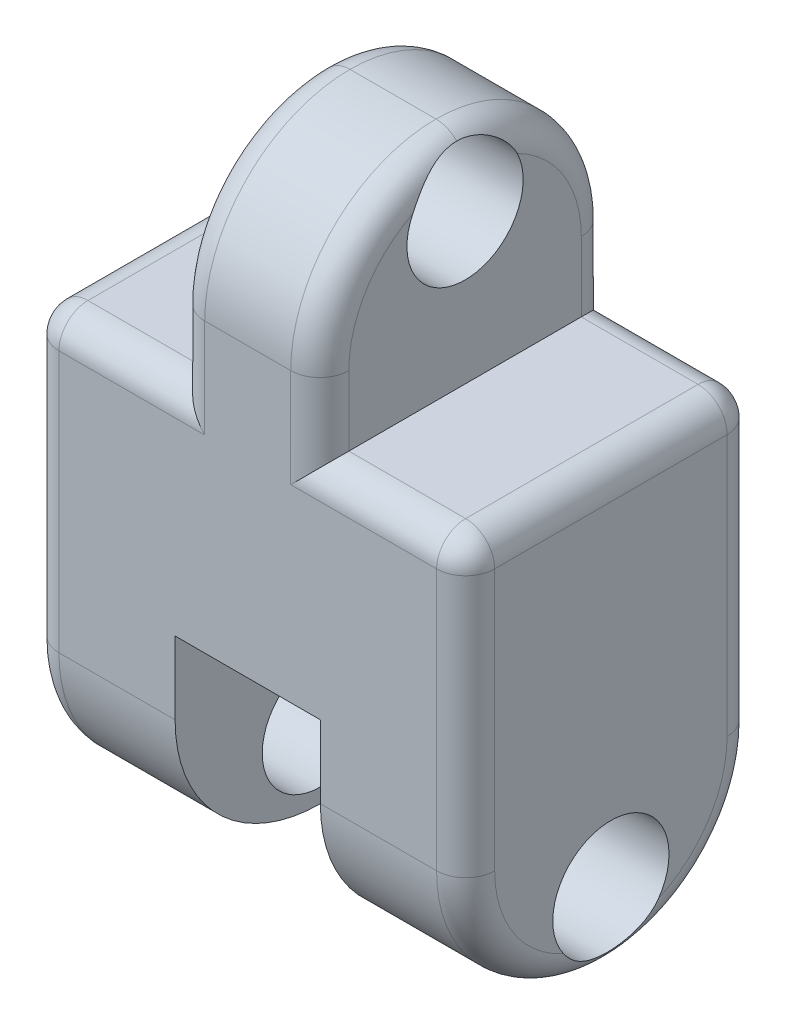
from build123d import *

# Parameters (mm, degrees)
BOSS_EXTRUDE1_DEPTH    = 100
SKETCH2_W              = 50
SKETCH2_H              = 50
CUT_EXTRUDE1_DEPTH     = 195.489074243
FILLET1_R              = 50
CUT_EXTRUDE2_DEPTH     = 25
SKETCH7_R              = 20
CUT_EXTRUDE3_DEPTH     = 234.882449106
FILLET2_R              = 50
CUT_EXTRUDE6_START     = -75
CUT_EXTRUDE6_OUTLINE_W = 50
CUT_EXTRUDE6_OUTLINE_H = 6.698729811
CUT_EXTRUDE6_DEPTH     = 50
CUT_EXTRUDE7_DEPTH     = 25
FILLET3_R              = 10
SKETCH11_W             = 50
SKETCH11_H             = 25
CUT_EXTRUDE8_DEPTH     = 99
BOSS_EXTRUDE7_DEPTH    = 0.1
FILLET4_R              = 10
FILLET5_R              = 10
SKETCH14_R             = 20
CUT_EXTRUDE9_DEPTH     = 206.380257205


with BuildPart() as part:
    # Sketch1 → Boss-Extrude1 (new body)
    with BuildSketch(Plane.XY):
        Polygon((-24.8, 75), (-24.8, 149), (24.8, 149), (24.8, 75), (75, 75), (75, -75), (-75, -75), (-75, 75), align=None)
    extrude(amount=-BOSS_EXTRUDE1_DEPTH)

    # Sketch2 → Cut-Extrude1 (cut, through all)
    with BuildSketch(Plane.XY):
        with Locations((0, -75)):
            Rectangle(SKETCH2_W, SKETCH2_H)
    extrude(amount=-CUT_EXTRUDE1_DEPTH, mode=Mode.SUBTRACT)

    # Fillet1
    fillet1_edges = [part.edges().sort_by_distance(p)[0] for p in [
        (0, 149, -100),
        (0, 149, 0),
    ]]
    fillet(fillet1_edges, radius=FILLET1_R - 0.0001)  # a hair under: the kernel refuses the full size

    # Sketch6 → Cut-Extrude2 (cut, symmetric)
    with BuildSketch(Plane(origin=(0, 0, 0), x_dir=(0, 0, -1), z_dir=(1, 0, 0))):
        with BuildLine():
            Line((100, -50), (0, -50))
            ThreePointArc((0, -50), (50, 0), (100, -50))
        make_face()
    extrude(amount=CUT_EXTRUDE2_DEPTH, both=True, mode=Mode.SUBTRACT)

    # Sketch7 → Cut-Extrude3 (cut, through all)
    with BuildSketch(Plane.ZY.offset(75)):
        with Locations(Location((-50, -50, 0), (0, 0, 270))):
            Circle(SKETCH7_R)
    extrude(amount=-CUT_EXTRUDE3_DEPTH, mode=Mode.SUBTRACT)

    # Fillet2
    fillet2_edges = [part.edges().sort_by_distance(p)[0] for p in [
        (-50, -75, -100),
        (-50, -75, 0),
    ]]
    fillet(fillet2_edges, radius=FILLET2_R - 0.0001)  # a hair under: the kernel refuses the full size

    # Cut-Extrude6: read off the stored shape, not the designer's step
    # Cut-Extrude6 outline → Cut-Extrude6 (cut)
    with BuildSketch(Plane(origin=(0, 0, 0), x_dir=(1, 0, 0), z_dir=(0, 1, 0)).offset(CUT_EXTRUDE6_START)):
        with Locations((0, 96.650635095)):
            Rectangle(CUT_EXTRUDE6_OUTLINE_W, CUT_EXTRUDE6_OUTLINE_H)
        with Locations((0, 3.349364906)):
            Rectangle(CUT_EXTRUDE6_OUTLINE_W, CUT_EXTRUDE6_OUTLINE_H)
    extrude(amount=CUT_EXTRUDE6_DEPTH, mode=Mode.SUBTRACT)

    # Sketch10 → Cut-Extrude7 (cut, symmetric)
    with BuildSketch(Plane(origin=(0, 0, 0), x_dir=(0, 0, -1), z_dir=(1, 0, 0))):
        with BuildLine():
            Line((0, -25), (100, -25))
            ThreePointArc((100, -25), (50, -11.611517322), (0, -25))
        make_face()
    extrude(amount=CUT_EXTRUDE7_DEPTH, both=True, mode=Mode.SUBTRACT)

    # Fillet3
    # the kernel refuses this fillet: 10 mm, written as the material it takes off along each edge
    with BuildSketch(Plane(origin=(24.8, 99.0001, -100), x_dir=(0, 0, 1), z_dir=(0, -1, 0)), Plane(origin=(-24.8, 75, 0), x_dir=(1, 0, 0), z_dir=(0, 1, 0)), Plane(origin=(-24.8, 75, -100), x_dir=(0, 0, 1), z_dir=(0, 1, 0)), Plane(origin=(24.8, 99.0001, 0), x_dir=(-1, 0, 0), z_dir=(0, -1, 0))) as fillet3_piece_1:
        with BuildLine():
            CenterArc((FILLET3_R, FILLET3_R), FILLET3_R, 180, 90)
            Line((0, FILLET3_R), (0, 0))
            Line((0, 0), (FILLET3_R, 0))
        make_face()
    extrude(amount=24.0001, mode=Mode.SUBTRACT)
    with BuildSketch(Plane(origin=(24.8, 75, 0), x_dir=(0, -1, 0), z_dir=(1, 0, 0)), Plane(origin=(-100, 75, -100), x_dir=(0, 0, 1), z_dir=(1, 0, 0)), Plane(origin=(24.8, 75, -100), x_dir=(0, 0, 1), z_dir=(1, 0, 0)), Plane(origin=(-100, 75, 0), x_dir=(0, -1, 0), z_dir=(1, 0, 0))) as fillet3_piece_2:
        with BuildLine():
            CenterArc((FILLET3_R, FILLET3_R), FILLET3_R, 180, 90)
            Line((0, FILLET3_R), (0, 0))
            Line((0, 0), (FILLET3_R, 0))
        make_face()
    extrude(amount=75.2, mode=Mode.SUBTRACT)
    with BuildSketch(Plane(origin=(-75, -25.0001, -100), x_dir=(0, 0, 1), z_dir=(0, 1, 0)), Plane(origin=(75, 100, 0), x_dir=(-1, 0, 0), z_dir=(0, -1, 0)), Plane(origin=(75, 100, -100), x_dir=(0, 0, 1), z_dir=(0, -1, 0)), Plane(origin=(-75, -25.0001, 0), x_dir=(1, 0, 0), z_dir=(0, 1, 0))) as fillet3_piece_3:
        with BuildLine():
            CenterArc((FILLET3_R, FILLET3_R), FILLET3_R, 180, 90)
            Line((0, FILLET3_R), (0, 0))
            Line((0, 0), (FILLET3_R, 0))
        make_face()
    extrude(amount=125.0001, mode=Mode.SUBTRACT)
    with BuildSketch(Plane(origin=(-24.8, 99.0001, -49.9999), x_dir=(0, 1, 0), z_dir=(0, 0, -1))) as fillet3_piece_4:
        with BuildLine():
            CenterArc((49.9999 - FILLET3_R, FILLET3_R), FILLET3_R, 270, 90)
            Line((49.9999 - FILLET3_R, 0), (49.9999, 0))
            Line((49.9999, 0), (49.9999, FILLET3_R))
        make_face()
    revolve(axis=Axis((-24.8, 99.0001, -49.9999), (1, 0, 0)), revolution_arc=90, mode=Mode.SUBTRACT)
    with BuildSketch(Plane(origin=(-24.8, 99.0001, -50.0001), x_dir=(0, 1, 0), z_dir=(0, 0, 1))) as fillet3_piece_5:
        with BuildLine():
            CenterArc((49.9999 - FILLET3_R, -FILLET3_R), FILLET3_R, 0, 90)
            Line((49.9999, -FILLET3_R), (49.9999, 0))
            Line((49.9999, 0), (49.9999 - FILLET3_R, 0))
        make_face()
    revolve(axis=Axis((-24.8, 99.0001, -50.0001), (-1, 0, 0)), revolution_arc=90, mode=Mode.SUBTRACT)
    with BuildSketch(Plane(origin=(24.8, 99.0001, -49.9999), x_dir=(0, 1, 0), z_dir=(0, 0, -1))) as fillet3_piece_6:
        with BuildLine():
            CenterArc((49.9999 - FILLET3_R, -FILLET3_R), FILLET3_R, 0, 90)
            Line((49.9999, -FILLET3_R), (49.9999, 0))
            Line((49.9999, 0), (49.9999 - FILLET3_R, 0))
        make_face()
    revolve(axis=Axis((24.8, 99.0001, -49.9999), (1, 0, 0)), revolution_arc=90, mode=Mode.SUBTRACT)
    with BuildSketch(Plane(origin=(24.8, 99.0001, -50.0001), x_dir=(0, 1, 0), z_dir=(0, 0, 1))) as fillet3_piece_7:
        with BuildLine():
            CenterArc((49.9999 - FILLET3_R, FILLET3_R), FILLET3_R, 270, 90)
            Line((49.9999, FILLET3_R), (49.9999, 0))
            Line((49.9999, 0), (49.9999 - FILLET3_R, 0))
        make_face()
    revolve(axis=Axis((24.8, 99.0001, -50.0001), (-1, 0, 0)), revolution_arc=90, mode=Mode.SUBTRACT)
    with BuildSketch(Plane(origin=(75, -25.0001, -49.9999), x_dir=(0, 0, 1), z_dir=(0, 1, 0))) as fillet3_piece_8:
        with BuildLine():
            CenterArc((49.9999 - FILLET3_R, -FILLET3_R), FILLET3_R, 0, 90)
            Line((49.9999, -FILLET3_R), (49.9999, 0))
            Line((49.9999, 0), (49.9999 - FILLET3_R, 0))
        make_face()
    revolve(axis=Axis((75, -25.0001, -49.9999), (1, 0, 0)), revolution_arc=90, mode=Mode.SUBTRACT)
    with BuildSketch(Plane(origin=(75, -25.0001, -50.0001), x_dir=(0, 0, -1), z_dir=(0, 1, 0))) as fillet3_piece_9:
        with BuildLine():
            CenterArc((49.9999 - FILLET3_R, FILLET3_R), FILLET3_R, 270, 90)
            Line((49.9999, FILLET3_R), (49.9999, 0))
            Line((49.9999, 0), (49.9999 - FILLET3_R, 0))
        make_face()
    revolve(axis=Axis((75, -25.0001, -50.0001), (-1, 0, 0)), revolution_arc=90, mode=Mode.SUBTRACT)
    with BuildSketch(Plane(origin=(-75, -25.0001, -49.9999), x_dir=(0, 0, 1), z_dir=(0, 1, 0))) as fillet3_piece_10:
        with BuildLine():
            CenterArc((49.9999 - FILLET3_R, FILLET3_R), FILLET3_R, 270, 90)
            Line((49.9999, FILLET3_R), (49.9999, 0))
            Line((49.9999, 0), (49.9999 - FILLET3_R, 0))
        make_face()
    revolve(axis=Axis((-75, -25.0001, -49.9999), (1, 0, 0)), revolution_arc=90, mode=Mode.SUBTRACT)
    with BuildSketch(Plane(origin=(-75, -25.0001, -50.0001), x_dir=(0, 0, -1), z_dir=(0, 1, 0))) as fillet3_piece_11:
        with BuildLine():
            CenterArc((49.9999 - FILLET3_R, -FILLET3_R), FILLET3_R, 0, 90)
            Line((49.9999, -FILLET3_R), (49.9999, 0))
            Line((49.9999, 0), (49.9999 - FILLET3_R, 0))
        make_face()
    revolve(axis=Axis((-75, -25.0001, -50.0001), (-1, 0, 0)), revolution_arc=90, mode=Mode.SUBTRACT)
    with BuildSketch(Plane(origin=(-75, -75, -49.9999), x_dir=(0, 1, 0), z_dir=(0, 0, -1)), Plane(origin=(24.8, 149, -49.9999), x_dir=(0, -1, 0), z_dir=(0, 0, -1))) as fillet3_piece_12:
        with BuildLine():
            CenterArc((FILLET3_R, FILLET3_R), FILLET3_R, 180, 90)
            Line((0, FILLET3_R), (0, 0))
            Line((0, 0), (FILLET3_R, 0))
        make_face()
    extrude(amount=0.0002, mode=Mode.SUBTRACT)
    with BuildSketch(Plane(origin=(75, -75, -49.9999), x_dir=(0, 1, 0), z_dir=(0, 0, -1)), Plane(origin=(-24.8, 149, -49.9999), x_dir=(0, -1, 0), z_dir=(0, 0, -1))) as fillet3_piece_13:
        with BuildLine():
            CenterArc((FILLET3_R, -FILLET3_R), FILLET3_R, 90, 90)
            Line((0, -FILLET3_R), (0, 0))
            Line((0, 0), (FILLET3_R, 0))
        make_face()
    extrude(amount=0.0002, mode=Mode.SUBTRACT)
    with BuildSketch(Plane(origin=(-0.2, 75, -100), x_dir=(0, 0, 1), z_dir=(1, 0, 0))) as fillet3_piece_14a_section:
        with BuildLine():
            CenterArc((FILLET3_R, FILLET3_R), FILLET3_R, 180, 90)
            Line((0, FILLET3_R), (0, 0))
            Line((0, 0), (FILLET3_R, 0))
        make_face()
    fillet3_piece_14a = extrude(amount=100.2, mode=Mode.PRIVATE)
    fillet3_piece_14a = split(fillet3_piece_14a, bisect_by=Plane(origin=(24.8, 75, -100), z_dir=(-1, 0, 0)), keep=Keep.TOP, mode=Mode.PRIVATE)
    with BuildSketch(Plane(origin=(24.8, 99.0001, -100), x_dir=(0, 0, 1), z_dir=(0, -1, 0))) as fillet3_piece_14b_section:
        with BuildLine():
            CenterArc((FILLET3_R, FILLET3_R), FILLET3_R, 180, 90)
            Line((0, FILLET3_R), (0, 0))
            Line((0, 0), (FILLET3_R, 0))
        make_face()
    fillet3_piece_14b = extrude(amount=49.0001, mode=Mode.PRIVATE)
    fillet3_piece_14b = split(fillet3_piece_14b, bisect_by=Plane(origin=(24.8, 75, -100), z_dir=(0, -1, 0)), keep=Keep.TOP, mode=Mode.PRIVATE)
    fillet3_piece_14 = fillet3_piece_14a & fillet3_piece_14b
    add(fillet3_piece_14, mode=Mode.SUBTRACT)
    with BuildSketch(Plane(origin=(-0.2, 75, 0), x_dir=(0, -1, 0), z_dir=(1, 0, 0))) as fillet3_piece_15a_section:
        with BuildLine():
            CenterArc((FILLET3_R, FILLET3_R), FILLET3_R, 180, 90)
            Line((0, FILLET3_R), (0, 0))
            Line((0, 0), (FILLET3_R, 0))
        make_face()
    fillet3_piece_15a = extrude(amount=100.2, mode=Mode.PRIVATE)
    fillet3_piece_15a = split(fillet3_piece_15a, bisect_by=Plane(origin=(24.8, 75, 0), z_dir=(-1, 0, 0)), keep=Keep.TOP, mode=Mode.PRIVATE)
    with BuildSketch(Plane(origin=(24.8, 99.0001, 0), x_dir=(-1, 0, 0), z_dir=(0, -1, 0))) as fillet3_piece_15b_section:
        with BuildLine():
            CenterArc((FILLET3_R, FILLET3_R), FILLET3_R, 180, 90)
            Line((0, FILLET3_R), (0, 0))
            Line((0, 0), (FILLET3_R, 0))
        make_face()
    fillet3_piece_15b = extrude(amount=49.0001, mode=Mode.PRIVATE)
    fillet3_piece_15b = split(fillet3_piece_15b, bisect_by=Plane(origin=(24.8, 75, 0), z_dir=(0, -1, 0)), keep=Keep.TOP, mode=Mode.PRIVATE)
    fillet3_piece_15 = fillet3_piece_15a & fillet3_piece_15b
    add(fillet3_piece_15, mode=Mode.SUBTRACT)
    with BuildSketch(Plane(origin=(-24.8, 50, -100), x_dir=(0, 0, 1), z_dir=(0, 1, 0))) as fillet3_piece_16a_section:
        with BuildLine():
            CenterArc((FILLET3_R, FILLET3_R), FILLET3_R, 180, 90)
            Line((0, FILLET3_R), (0, 0))
            Line((0, 0), (FILLET3_R, 0))
        make_face()
    fillet3_piece_16a = extrude(amount=49.0001, mode=Mode.PRIVATE)
    fillet3_piece_16a = split(fillet3_piece_16a, bisect_by=Plane(origin=(-24.8, 75, -100), z_dir=(0, -1, 0)), keep=Keep.TOP, mode=Mode.PRIVATE)
    with BuildSketch(Plane(origin=(-100, 75, -100), x_dir=(0, 0, 1), z_dir=(1, 0, 0))) as fillet3_piece_16b_section:
        with BuildLine():
            CenterArc((FILLET3_R, FILLET3_R), FILLET3_R, 180, 90)
            Line((0, FILLET3_R), (0, 0))
            Line((0, 0), (FILLET3_R, 0))
        make_face()
    fillet3_piece_16b = extrude(amount=100.2, mode=Mode.PRIVATE)
    fillet3_piece_16b = split(fillet3_piece_16b, bisect_by=Plane(origin=(-24.8, 75, -100), z_dir=(1, 0, 0)), keep=Keep.TOP, mode=Mode.PRIVATE)
    fillet3_piece_16 = fillet3_piece_16a & fillet3_piece_16b
    add(fillet3_piece_16, mode=Mode.SUBTRACT)
    with BuildSketch(Plane(origin=(-24.8, 50, 0), x_dir=(1, 0, 0), z_dir=(0, 1, 0))) as fillet3_piece_17a_section:
        with BuildLine():
            CenterArc((FILLET3_R, FILLET3_R), FILLET3_R, 180, 90)
            Line((0, FILLET3_R), (0, 0))
            Line((0, 0), (FILLET3_R, 0))
        make_face()
    fillet3_piece_17a = extrude(amount=49.0001, mode=Mode.PRIVATE)
    fillet3_piece_17a = split(fillet3_piece_17a, bisect_by=Plane(origin=(-24.8, 75, 0), z_dir=(0, -1, 0)), keep=Keep.TOP, mode=Mode.PRIVATE)
    with BuildSketch(Plane(origin=(-100, 75, 0), x_dir=(0, -1, 0), z_dir=(1, 0, 0))) as fillet3_piece_17b_section:
        with BuildLine():
            CenterArc((FILLET3_R, FILLET3_R), FILLET3_R, 180, 90)
            Line((0, FILLET3_R), (0, 0))
            Line((0, 0), (FILLET3_R, 0))
        make_face()
    fillet3_piece_17b = extrude(amount=100.2, mode=Mode.PRIVATE)
    fillet3_piece_17b = split(fillet3_piece_17b, bisect_by=Plane(origin=(-24.8, 75, 0), z_dir=(1, 0, 0)), keep=Keep.TOP, mode=Mode.PRIVATE)
    fillet3_piece_17 = fillet3_piece_17a & fillet3_piece_17b
    add(fillet3_piece_17, mode=Mode.SUBTRACT)

    # Sketch11 → Cut-Extrude8 (cut)
    with BuildSketch(Plane.XY):
        with Locations((0, -12.5)):
            Rectangle(SKETCH11_W, SKETCH11_H)
    extrude(amount=-CUT_EXTRUDE8_DEPTH, mode=Mode.SUBTRACT)

    # Fillet5
    # the kernel refuses this fillet: 10 mm, written as the material it takes off along each edge
    with BuildSketch(Plane(origin=(65, 65, -10), x_dir=(0, 1, 0), z_dir=(1, 0, 0))) as fillet5_piece_1_section:
        Polygon((0, 0), (FILLET5_R, 0), (FILLET5_R, FILLET5_R), (0, FILLET5_R), align=None)
    fillet5_piece_1 = extrude(amount=FILLET5_R, mode=Mode.PRIVATE)
    fillet5_piece_1 = fillet5_piece_1 - Plane(origin=(65, 65, -10), x_dir=(0, -0.7071067811865475, -0.7071067811865475), z_dir=(1, 0, 0)) * Sphere(FILLET5_R, mode=Mode.PRIVATE)
    add(fillet5_piece_1, mode=Mode.SUBTRACT)
    with BuildSketch(Plane(origin=(65, 65, -90), x_dir=(0, 1, 0), z_dir=(1, 0, 0))) as fillet5_piece_2_section:
        Polygon((0, 0), (FILLET5_R, 0), (FILLET5_R, -FILLET5_R), (0, -FILLET5_R), align=None)
    fillet5_piece_2 = extrude(amount=FILLET5_R, mode=Mode.PRIVATE)
    fillet5_piece_2 = fillet5_piece_2 - Plane(origin=(65, 65, -90), x_dir=(0, -0.7071067811865475, 0.7071067811865475), z_dir=(1, 0, 0)) * Sphere(FILLET5_R, mode=Mode.PRIVATE)
    add(fillet5_piece_2, mode=Mode.SUBTRACT)
    with BuildSketch(Plane(origin=(-65, 65, -90), x_dir=(0, 1, 0), z_dir=(-1, 0, 0))) as fillet5_piece_3_section:
        Polygon((0, 0), (FILLET5_R, 0), (FILLET5_R, FILLET5_R), (0, FILLET5_R), align=None)
    fillet5_piece_3 = extrude(amount=FILLET5_R, mode=Mode.PRIVATE)
    fillet5_piece_3 = fillet5_piece_3 - Plane(origin=(-65, 65, -90), x_dir=(0, -0.7071067811865475, 0.7071067811865475), z_dir=(-1, 0, 0)) * Sphere(FILLET5_R, mode=Mode.PRIVATE)
    add(fillet5_piece_3, mode=Mode.SUBTRACT)
    with BuildSketch(Plane(origin=(-65, 65, -10), x_dir=(0, 1, 0), z_dir=(-1, 0, 0))) as fillet5_piece_4_section:
        Polygon((0, 0), (FILLET5_R, 0), (FILLET5_R, -FILLET5_R), (0, -FILLET5_R), align=None)
    fillet5_piece_4 = extrude(amount=FILLET5_R, mode=Mode.PRIVATE)
    fillet5_piece_4 = fillet5_piece_4 - Plane(origin=(-65, 65, -10), x_dir=(0, -0.7071067811865475, -0.7071067811865475), z_dir=(-1, 0, 0)) * Sphere(FILLET5_R, mode=Mode.PRIVATE)
    add(fillet5_piece_4, mode=Mode.SUBTRACT)
    with BuildSketch(Plane(origin=(75, 75, -10), x_dir=(0, -1, 0), z_dir=(0, 0, -1))) as fillet5_piece_5:
        with BuildLine():
            CenterArc((FILLET5_R, FILLET5_R), FILLET5_R, 180, 90)
            Line((0, FILLET5_R), (0, 0))
            Line((0, 0), (FILLET5_R, 0))
        make_face()
    extrude(amount=80, mode=Mode.SUBTRACT)
    with BuildSketch(Plane(origin=(-75, 75, -10), x_dir=(0, -1, 0), z_dir=(0, 0, -1))) as fillet5_piece_6:
        with BuildLine():
            CenterArc((FILLET5_R, -FILLET5_R), FILLET5_R, 90, 90)
            Line((0, -FILLET5_R), (0, 0))
            Line((0, 0), (FILLET5_R, 0))
        make_face()
    extrude(amount=80, mode=Mode.SUBTRACT)

    # Sketch14 → Cut-Extrude9 (cut, through all)
    with BuildSketch(Plane(origin=(24.8, 0, 0), x_dir=(0, 0, -1), z_dir=(1, 0, 0))):
        with Locations(Location((50, 126, 0), (0, 0, 25.856016698))):
            Circle(SKETCH14_R)
    extrude(amount=-CUT_EXTRUDE9_DEPTH, mode=Mode.SUBTRACT)


with BuildPart() as body_2:
    # Sketch13 → Boss-Extrude7 (new body)
    with BuildSketch(Plane(origin=(0, 0, -100), x_dir=(-1, 0, 0), z_dir=(0, 0, -1))):
        Polygon((-25, -25), (-25, -55), (25.018802851, -55), (25, -25), align=None)
    extrude(amount=BOSS_EXTRUDE7_DEPTH)

    # Fillet4
    # the kernel refuses this fillet: 10 mm, written as the material it takes off along each edge
    with BuildSketch(Plane(origin=(-25.021013242, -58.526683302, -100.1), x_dir=(0, 0, 1), z_dir=(0.0006267615930632001, 0.9999998035849335, 0))) as fillet4_piece_1:
        with BuildLine():
            CenterArc((10, 1.410673598), FILLET4_R, 180, 8.109614456)
            Line((0, 1.410673598), (0, 0))
            Line((0, 0), (0.1, 0))
        make_face()
    extrude(amount=37.053373882, mode=Mode.SUBTRACT)
    with BuildSketch(Plane(origin=(25, -21.473316005, -100.1), x_dir=(0, 0, 1), z_dir=(0, -1, 0))) as fillet4_piece_2:
        with BuildLine():
            CenterArc((10, 1.410673598), FILLET4_R, 180, 8.109614456)
            Line((0, 1.410673598), (0, 0))
            Line((0, 0), (0.1, 0))
        make_face()
    extrude(amount=37.05336799, mode=Mode.SUBTRACT)
    with BuildSketch(Plane(origin=(28.526683995, -55, -100.1), x_dir=(0, 0, 1), z_dir=(-1, 0, 0))) as fillet4_piece_3:
        with BuildLine():
            CenterArc((10, 1.410673598), FILLET4_R, 180, 8.109614456)
            Line((0, 1.410673598), (0, 0))
            Line((0, 0), (0.1, 0))
        make_face()
    extrude(amount=57.072170841, mode=Mode.SUBTRACT)


solid = Compound([part.part, body_2.part])
